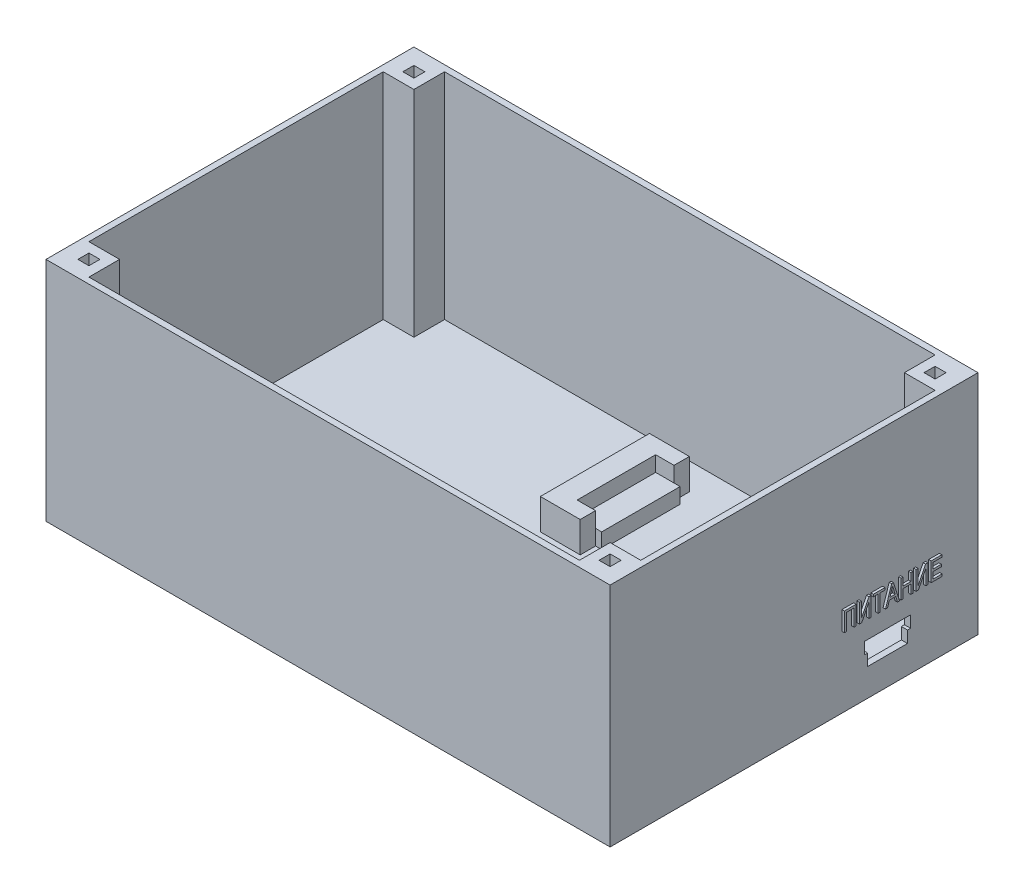
from build123d import *

# Parameters (mm, degrees)
SKETCH_2_W          = 92
SKETCH_2_H          = 60
EXTRUDE_1_DEPTH     = 2
SKETCH_14_W         = 92
SKETCH_14_H         = 60
SKETCH_14_W_2       = 90
SKETCH_14_H_2       = 58
EXTRUDE_9_DEPTH     = 35
SKETCH_18_W         = 4
SKETCH_18_H         = 12.8
EXTRUDE_12_DEPTH    = 2.5
SKETCH_19_W         = 3
SKETCH_19_H         = 2.5
EXTRUDE_13_DEPTH    = 5
SKETCH_20_W         = 3.5
SKETCH_20_H         = 17.8
EXTRUDE_14_DEPTH    = 5
CUT_EXTRUDE_1_DEPTH = 5
SKETCH_21_W         = 2.706084524
SKETCH_21_H         = 20.3
EXTRUDE_16_DEPTH    = 2.5
SKETCH_22_W         = 2.706084524
SKETCH_22_H         = 2.5
EXTRUDE_17_DEPTH    = 5
SKETCH_16_W         = 5
SKETCH_16_H         = 5
SKETCH_16_W_2       = 1.8
SKETCH_16_H_2       = 1.8
EXTRUDE_19_DEPTH    = 35
EXTRUDE_20_DEPTH    = 0.4
SKETCH_24_W         = 9.7
SKETCH_24_H         = 4.6
CUT_EXTRUDE_2_DEPTH = 1
EXTRUDE_21_DEPTH    = 0.4


with BuildPart() as part:
    # Эскиз2 → Бобышка-Вытянуть1 (new body)
    with BuildSketch(Plane(origin=(0, 0, 0), x_dir=(1, 0, 0), z_dir=(0, 1, 0))):
        with Locations((46, 30)):
            Rectangle(SKETCH_2_W, SKETCH_2_H)
    extrude(amount=EXTRUDE_1_DEPTH)



with BuildPart() as body_2:
    # Эскиз14 → Бобышка-Вытянуть9 (new body)
    with BuildSketch(Plane(origin=(0, 2, 0), x_dir=(1, 0, 0), z_dir=(0, 1, 0))):
        with Locations((46, 30)):
            Rectangle(SKETCH_14_W, SKETCH_14_H)
        with Locations((46, 30)):
            Rectangle(SKETCH_14_W_2, SKETCH_14_H_2, mode=Mode.SUBTRACT)
    extrude(amount=EXTRUDE_9_DEPTH)


with BuildPart() as part_1:
    add(part.part)

    add(body_2.part)  # Бобышка-Вытянуть12 merges body 2
    # Эскиз18 → Бобышка-Вытянуть12 (add)
    with BuildSketch(Plane(origin=(0, 2, 0), x_dir=(1, 0, 0), z_dir=(0, 1, 0))):
        with Locations((49.3, 45.72407939)):
            Rectangle(SKETCH_18_W, SKETCH_18_H)
    extrude(amount=EXTRUDE_12_DEPTH)

    # Эскиз19 → Бобышка-Вытянуть13 (add)
    with BuildSketch(Plane(origin=(0, 2, 0), x_dir=(1, 0, 0), z_dir=(0, 1, 0))):
        with Locations((48.8, 38.07407939)):
            Rectangle(SKETCH_19_W, SKETCH_19_H)
        with Locations((48.8, 53.37407939)):
            Rectangle(SKETCH_19_W, SKETCH_19_H)
    extrude(amount=EXTRUDE_13_DEPTH)

    # Эскиз20 → Бобышка-Вытянуть14 (add)
    with BuildSketch(Plane(origin=(0, 2, 0), x_dir=(1, 0, 0), z_dir=(0, 1, 0))):
        with Locations((45.55, 45.72407939)):
            Rectangle(SKETCH_20_W, SKETCH_20_H)
    extrude(amount=EXTRUDE_14_DEPTH)

    # Эскиз17 → Вырез-Вытянуть1 (cut)
    with BuildSketch(Plane(origin=(92, 0, 0), x_dir=(0, 0, -1), z_dir=(1, 0, 0))):
        Polygon((41.5, 8.3), (49, 8.3), (49, 6.4), (48.5, 6.4), (48.5, 4.5), (42, 4.5), (42, 6.4), (41.5, 6.4), align=None)
    extrude(amount=-CUT_EXTRUDE_1_DEPTH, mode=Mode.SUBTRACT)

    # Эскиз21 → Бобышка-Вытянуть16 (add)
    with BuildSketch(Plane(origin=(0, 2, 0), x_dir=(1, 0, 0), z_dir=(0, 1, 0))):
        with Locations((2.353042262, 16.15)):
            Rectangle(SKETCH_21_W, SKETCH_21_H)
        with Locations((89.646957738, 16.15)):
            Rectangle(SKETCH_21_W, SKETCH_21_H)
    extrude(amount=EXTRUDE_16_DEPTH)

    # Эскиз22 → Бобышка-Вытянуть17 (add)
    with BuildSketch(Plane(origin=(0, 2, 0), x_dir=(1, 0, 0), z_dir=(0, 1, 0))):
        with Locations((2.353042262, 27.55)):
            Rectangle(SKETCH_22_W, SKETCH_22_H)
        with Locations((89.646957738, 27.55)):
            Rectangle(SKETCH_22_W, SKETCH_22_H)
    extrude(amount=EXTRUDE_17_DEPTH)

    # Эскиз16 → Бобышка-Вытянуть19 (add)
    # profile 1 of 4: a face of its own
    with BuildSketch(Plane(origin=(0, 2, 0), x_dir=(1, 0, 0), z_dir=(0, 1, 0))):
        with Locations((3.5, 56.5)):
            Rectangle(SKETCH_16_W, SKETCH_16_H)
        with Locations((3.5, 56.5)):
            Rectangle(SKETCH_16_W_2, SKETCH_16_H_2, mode=Mode.SUBTRACT)
    # profile 2 of 4: a face of its own
    with BuildSketch(Plane(origin=(0, 2, 0), x_dir=(1, 0, 0), z_dir=(0, 1, 0))):
        with Locations((88.5, 3.5)):
            Rectangle(SKETCH_16_W, SKETCH_16_H)
        with Locations((88.5, 3.5)):
            Rectangle(SKETCH_16_W_2, SKETCH_16_H_2, mode=Mode.SUBTRACT)
    # profile 3 of 4: a face of its own
    with BuildSketch(Plane(origin=(0, 2, 0), x_dir=(1, 0, 0), z_dir=(0, 1, 0))):
        with Locations((3.5, 3.5)):
            Rectangle(SKETCH_16_W, SKETCH_16_H)
        with Locations((3.5, 3.5)):
            Rectangle(SKETCH_16_W_2, SKETCH_16_H_2, mode=Mode.SUBTRACT)
    # profile 4 of 4: a face of its own
    with BuildSketch(Plane(origin=(0, 2, 0), x_dir=(1, 0, 0), z_dir=(0, 1, 0))):
        with Locations((88.5, 56.5)):
            Rectangle(SKETCH_16_W, SKETCH_16_H)
        with Locations((88.5, 56.5)):
            Rectangle(SKETCH_16_W_2, SKETCH_16_H_2, mode=Mode.SUBTRACT)
    extrude(amount=EXTRUDE_19_DEPTH)

    # Эскиз23 → Бобышка-Вытянуть20 (add)
    # profile 1 of 7: a face of its own
    with BuildSketch(Plane(origin=(92, 0, 0), x_dir=(0, 0, -1), z_dir=(1, 0, 0))):
        Polygon((37.820297464, 14.633638566), (39.716902031, 14.633638566), (39.716902031, 11.551656144), (39.40080127, 11.551656144), (39.40080127, 14.278025209), (38.136398225, 14.278025209), (38.136398225, 11.551656144), (37.820297464, 11.551656144), align=None)
    # profile 2 of 7: a face of its own
    with BuildSketch(Plane(origin=(92, 0, 0), x_dir=(0, 0, -1), z_dir=(1, 0, 0))):
        Polygon((40.270078363, 14.633638566), (40.586179124, 14.633638566), (40.586179124, 12.193118431), (41.807982653, 14.633638566), (42.166682931, 14.633638566), (42.166682931, 11.551656144), (41.850582169, 11.551656144), (41.850582169, 13.986002436), (40.631248178, 11.551656144), (40.270078363, 11.551656144), align=None)
    # profile 3 of 7: a face of its own
    with BuildSketch(Plane(origin=(92, 0, 0), x_dir=(0, 0, -1), z_dir=(1, 0, 0))):
        Polygon((43.31254819, 11.551656144), (43.31254819, 14.278025209), (42.522296287, 14.278025209), (42.522296287, 14.633638566), (44.418900854, 14.633638566), (44.418900854, 14.278025209), (43.628648951, 14.278025209), (43.628648951, 11.551656144), align=None)
    # profile 4 of 7: a face of its own
    with BuildSketch(Plane(origin=(92, 0, 0), x_dir=(0, 0, -1), z_dir=(1, 0, 0))):
        Polygon((44.516447573, 11.551656144), (45.514757985, 14.633638566), (45.812954602, 14.633638566), (46.811265014, 11.551656144), (46.473555802, 11.551656144), (46.192028562, 12.499958427), (45.135066641, 12.499958427), (44.853539401, 11.551656144), align=None)
        with BuildLine():
            Line((45.240639357, 12.855571784), (46.086455846, 12.855571784))
            Line((46.086455846, 12.855571784), (45.84567597, 13.664345216))
            add(Edge.make_bspline(
                [(45.84567597, 13.664345216), (45.836426209, 13.695629271), (45.81840739, 13.756571573), (45.791917269, 13.845492472), (45.766358364, 13.929527401), (45.743018253, 14.008795057), (45.721701904, 14.083295859), (45.700236272, 14.152384308), (45.681371857, 14.216880949), (45.669307011, 14.258268151), (45.663547602, 14.278025209)],
                knots=[0, 0, 0, 0, 1.223089462, 2.382615935, 3.47858657, 4.516186366, 5.480638401, 6.383728134, 7.228438372, 8, 8, 8, 8], degree=3))
            add(Edge.make_bspline(
                [(45.663547602, 14.278025209), (45.635377776, 14.18294088), (45.578724644, 13.9917141), (45.521779603, 13.800574044), (45.493149535, 13.704475195)],
                knots=[0, 0, 0, 0, 0.994466669, 2, 2, 2, 2], degree=3))
            Line((45.493149535, 13.704475195), (45.240639357, 12.855571784))
        make_face(mode=Mode.SUBTRACT)
    # profile 5 of 7: a face of its own
    with BuildSketch(Plane(origin=(92, 0, 0), x_dir=(0, 0, -1), z_dir=(1, 0, 0))):
        Polygon((47.066244729, 11.551656144), (47.066244729, 14.633638566), (47.382345491, 14.633638566), (47.382345491, 13.369235521), (48.646748535, 13.369235521), (48.646748535, 14.633638566), (48.962849297, 14.633638566), (48.962849297, 11.551656144), (48.646748535, 11.551656144), (48.646748535, 13.013622164), (47.382345491, 13.013622164), (47.382345491, 11.551656144), align=None)
    # profile 6 of 7: a face of its own
    with BuildSketch(Plane(origin=(92, 0, 0), x_dir=(0, 0, -1), z_dir=(1, 0, 0))):
        Polygon((49.516025629, 14.633638566), (49.83212639, 14.633638566), (49.83212639, 12.193118431), (51.053929918, 14.633638566), (51.412630196, 14.633638566), (51.412630196, 11.551656144), (51.096529435, 11.551656144), (51.096529435, 13.986002436), (49.877195444, 11.551656144), (49.516025629, 11.551656144), align=None)
    # profile 7 of 7: a face of its own
    with BuildSketch(Plane(origin=(92, 0, 0), x_dir=(0, 0, -1), z_dir=(1, 0, 0))):
        Polygon((51.965806528, 11.551656144), (51.965806528, 14.633638566), (53.704360715, 14.633638566), (53.704360715, 14.278025209), (52.28190729, 14.278025209), (52.28190729, 13.329722926), (53.625335525, 13.329722926), (53.625335525, 12.974109569), (52.28190729, 12.974109569), (52.28190729, 11.9072695), (53.74387331, 11.9072695), (53.74387331, 11.551656144), align=None)
    extrude(amount=EXTRUDE_20_DEPTH)

    # Эскиз24 → Вырез-Вытянуть2 (cut)
    with BuildSketch(Plane(origin=(1, 0, 0), x_dir=(0, 0, -1), z_dir=(1, 0, 0))):
        with Locations((17.746202532, 11.8)):
            Rectangle(SKETCH_24_W, SKETCH_24_H)
    extrude(amount=-CUT_EXTRUDE_2_DEPTH, mode=Mode.SUBTRACT)

    # Эскиз25 → Бобышка-Вытянуть21 (add)
    # profile 1 of 4: a face of its own
    with BuildSketch(Plane.ZY):
        with BuildLine():
            Line((-21.91266946, 21.587525959), (-21.348566896, 21.587525959))
            Line((-21.348566896, 21.587525959), (-21.348566896, 19.286243907))
            add(Edge.make_bspline(
                [(-21.348566896, 19.286243907), (-21.349152296, 19.237361581), (-21.350291487, 19.142236492), (-21.355532254, 19.003507344), (-21.365741505, 18.872486692), (-21.381371643, 18.749386429), (-21.399041567, 18.633672637), (-21.422575164, 18.525977914), (-21.44956627, 18.425867611), (-21.48062205, 18.332665361), (-21.518212184, 18.245741512), (-21.561159024, 18.163234693), (-21.611241968, 18.084904012), (-21.668331124, 18.010868358), (-21.732729396, 17.941532411), (-21.802678319, 17.875118809), (-21.880024387, 17.81345329), (-21.963916737, 17.755829963), (-22.05445955, 17.703532236), (-22.152049202, 17.658411678), (-22.256566645, 17.621210837), (-22.367539929, 17.589562805), (-22.485523063, 17.566099186), (-22.610137547, 17.548301586), (-22.741548365, 17.537833279), (-22.831454139, 17.536781544), (-22.877413049, 17.536243907)],
                knots=[0, 0, 0, 0, 1.311435591, 2.552055809, 3.723716842, 4.835547674, 5.880436826, 6.862821995, 7.791032428, 8.661143393, 9.495683908, 10.328993084, 11.1538804, 11.986573222, 12.833449924, 13.690091648, 14.571895854, 15.484149563, 16.418232274, 17.373591634, 18.364096258, 19.391643703, 20.466661433, 21.588422397, 22.767226238, 24, 24, 24, 24], degree=3))
            add(Edge.make_bspline(
                [(-22.877413049, 17.536243907), (-22.922297532, 17.536904605), (-23.009751443, 17.538191923), (-23.137907465, 17.546896763), (-23.259812, 17.562322693), (-23.375832956, 17.582566983), (-23.485580893, 17.610003348), (-23.588892874, 17.643585704), (-23.686121619, 17.682868601), (-23.777278753, 17.727563237), (-23.861298634, 17.779165575), (-23.939666638, 17.835491537), (-24.012032366, 17.897154443), (-24.077723568, 17.964710082), (-24.137519084, 18.037141164), (-24.19058553, 18.115221784), (-24.237049976, 18.199091201), (-24.278080798, 18.288528567), (-24.313829847, 18.384850395), (-24.342656463, 18.489369394), (-24.368735909, 18.601817292), (-24.388752416, 18.722602621), (-24.40633476, 18.851573712), (-24.416530876, 18.989111723), (-24.424299296, 19.134980024), (-24.425086211, 19.234949916), (-24.425489973, 19.286243907)],
                knots=[0, 0, 0, 0, 1.192889473, 2.324252067, 3.41162405, 4.457325556, 5.452435892, 6.415456921, 7.342133401, 8.237363544, 9.110250727, 9.959377435, 10.800155199, 11.633438097, 12.46053001, 13.293359256, 14.138649731, 15.005774073, 15.906391469, 16.865847877, 17.8852706, 18.972920589, 20.118424796, 21.343408205, 22.636917643, 24, 24, 24, 24], degree=3))
            Line((-24.425489973, 19.286243907), (-24.425489973, 21.587525959))
            Line((-24.425489973, 21.587525959), (-23.861387408, 21.587525959))
            Line((-23.861387408, 21.587525959), (-23.861387408, 19.312686215))
            add(Edge.make_bspline(
                [(-23.861387408, 19.312686215), (-23.861018817, 19.271284627), (-23.860307614, 19.191399654), (-23.856597014, 19.075677295), (-23.849176462, 18.968287646), (-23.840002694, 18.869066763), (-23.827390461, 18.778372952), (-23.811239141, 18.696339037), (-23.793122729, 18.622685649), (-23.765993641, 18.536551545), (-23.720961921, 18.440400946), (-23.649995151, 18.338489174), (-23.563401579, 18.249952501), (-23.460352664, 18.17683518), (-23.343329045, 18.118738028), (-23.213119591, 18.078679324), (-23.071269065, 18.052917649), (-22.972618471, 18.050379864), (-22.921483562, 18.04906442)],
                knots=[0, 0, 0, 0, 1.090245215, 2.103644224, 3.048223674, 3.924421557, 4.727106666, 5.45815927, 6.12513286, 6.723455763, 7.834131158, 8.905266051, 9.9795367, 11.078391299, 12.21701853, 13.404826756, 14.65480846, 16, 16, 16, 16], degree=3))
            add(Edge.make_bspline(
                [(-22.921483562, 18.04906442), (-22.877657231, 18.04981052), (-22.79303302, 18.051251162), (-22.671007312, 18.062869444), (-22.559138927, 18.084049815), (-22.456499413, 18.111344406), (-22.363811065, 18.14841188), (-22.28050716, 18.193321227), (-22.206879998, 18.246314124), (-22.14240125, 18.308826245), (-22.086844318, 18.383633745), (-22.040019901, 18.472786138), (-22.000131123, 18.576361119), (-21.967442781, 18.694700611), (-21.9436084, 18.82836667), (-21.924976291, 18.976498403), (-21.91520653, 19.139747051), (-21.913539495, 19.253380354), (-21.91266946, 19.312686215)],
                knots=[0, 0, 0, 0, 1.111629428, 2.146443922, 3.104513091, 3.997025448, 4.836178689, 5.630482806, 6.392099463, 7.129930272, 7.899580577, 8.745272349, 9.676297551, 10.710246713, 11.854352966, 13.117392195, 14.495550762, 16, 16, 16, 16], degree=3))
            Line((-21.91266946, 19.312686215), (-21.91266946, 21.587525959))
        make_face()
    # profile 2 of 4: a face of its own
    with BuildSketch(Plane.ZY):
        Polygon((-20.972765614, 17.587525959), (-19.384624588, 21.587525959), (-18.748406639, 21.587525959), (-17.160265614, 17.587525959), (-17.758823306, 17.587525959), (-18.213951511, 18.818295189), (-19.919079716, 18.818295189), (-20.374207921, 17.587525959), align=None)
        with BuildLine():
            Line((-19.749207921, 19.279833651), (-18.383823306, 19.279833651))
            Line((-18.383823306, 19.279833651), (-18.772445101, 20.331115702))
            add(Edge.make_bspline(
                [(-18.772445101, 20.331115702), (-18.787343473, 20.371735808), (-18.816472603, 20.451155784), (-18.859912913, 20.566546306), (-18.89959928, 20.676125881), (-18.938515021, 20.778323296), (-18.973644956, 20.874623071), (-19.006025118, 20.964374744), (-19.038048824, 21.046954499), (-19.057266701, 21.100309529), (-19.066515614, 21.125987497)],
                knots=[0, 0, 0, 0, 1.225184869, 2.395467751, 3.491410812, 4.525364584, 5.492066482, 6.394148129, 7.227157926, 8, 8, 8, 8], degree=3))
            add(Edge.make_bspline(
                [(-19.066515614, 21.125987497), (-19.0818151, 21.06266789), (-19.112477158, 20.93576759), (-19.176676043, 20.749841626), (-19.250117337, 20.565616039), (-19.309760419, 20.446902329), (-19.339752793, 20.387205446)],
                knots=[0, 0, 0, 0, 0.9891762, 1.982431084, 2.985436691, 4, 4, 4, 4], degree=3))
            Line((-19.339752793, 20.387205446), (-19.749207921, 19.279833651))
        make_face(mode=Mode.SUBTRACT)
    # profile 3 of 4: a face of its own
    with BuildSketch(Plane.ZY):
        with BuildLine():
            Line((-16.73318228, 17.587525959), (-16.73318228, 21.587525959))
            Line((-16.73318228, 21.587525959), (-14.997605357, 21.587525959))
            add(Edge.make_bspline(
                [(-14.997605357, 21.587525959), (-14.956737835, 21.587205745), (-14.877643529, 21.586586008), (-14.762940454, 21.582198977), (-14.655876633, 21.572741688), (-14.55625521, 21.562514948), (-14.464093886, 21.546818268), (-14.379487742, 21.528814531), (-14.302306148, 21.507389811), (-14.232204058, 21.482085566), (-14.167164604, 21.453457604), (-14.106877943, 21.41813532), (-14.048838035, 21.379429628), (-13.995198946, 21.333956217), (-13.944545938, 21.28416704), (-13.896925958, 21.229385569), (-13.853043982, 21.169136412), (-13.798920819, 21.082907374), (-13.740857701, 20.968068454), (-13.692482003, 20.821099519), (-13.661290219, 20.667364648), (-13.657952609, 20.562304674), (-13.656259203, 20.509000318)],
                knots=[0, 0, 0, 0, 1.242255013, 2.404239178, 3.487702428, 4.508875116, 5.447164253, 6.327763259, 7.137389581, 7.87956647, 8.591787438, 9.293660819, 10.000726923, 10.709654955, 11.427269343, 12.158170644, 12.913245971, 13.690346794, 15.251572448, 16.809945773, 18.381459854, 20, 20, 20, 20], degree=3))
            add(Edge.make_bspline(
                [(-13.656259203, 20.509000318), (-13.657041934, 20.474783675), (-13.65858788, 20.407203459), (-13.670429985, 20.307842452), (-13.691857318, 20.212907005), (-13.71933365, 20.121565692), (-13.756940365, 20.035112671), (-13.800506112, 19.951782114), (-13.854477879, 19.873863334), (-13.914905241, 19.799281478), (-13.98419922, 19.72963389), (-14.062969395, 19.667433285), (-14.150434934, 19.611483716), (-14.247007766, 19.563328854), (-14.351576239, 19.519313024), (-14.465452401, 19.483869357), (-14.588176658, 19.454926884), (-14.673254817, 19.440911822), (-14.717156639, 19.433679805)],
                knots=[0, 0, 0, 0, 0.982609109, 1.940720374, 2.867584677, 3.775009516, 4.675469332, 5.571146231, 6.471115823, 7.392408543, 8.32534739, 9.286126426, 10.269214477, 11.301811357, 12.381622301, 13.524260118, 14.722474812, 16, 16, 16, 16], degree=3))
            add(Edge.make_bspline(
                [(-14.717156639, 19.433679805), (-14.68495299, 19.417411231), (-14.6237971, 19.386516625), (-14.539126012, 19.33807415), (-14.467353262, 19.288577878), (-14.425771671, 19.253176689), (-14.406259203, 19.23656442)],
                knots=[0, 0, 0, 0, 1.172304973, 2.226249348, 3.167654437, 4, 4, 4, 4], degree=3))
            add(Edge.make_bspline(
                [(-14.406259203, 19.23656442), (-14.368472207, 19.199522121), (-14.290855031, 19.123434607), (-14.183895192, 18.993835281), (-14.080193955, 18.849571345), (-14.017187634, 18.745311309), (-13.984784844, 18.691692625)],
                knots=[0, 0, 0, 0, 0.918110279, 1.885863737, 2.912745394, 4, 4, 4, 4], degree=3))
            Line((-13.984784844, 18.691692625), (-13.328534844, 17.587525959))
            Line((-13.328534844, 17.587525959), (-13.97516946, 17.587525959))
            Line((-13.97516946, 17.587525959), (-14.473566896, 18.432077241))
            add(Edge.make_bspline(
                [(-14.473566896, 18.432077241), (-14.491486764, 18.461709337), (-14.526212526, 18.519131476), (-14.576372646, 18.602993744), (-14.625552995, 18.680202324), (-14.671166926, 18.75296388), (-14.715065532, 18.81995746), (-14.756824647, 18.881415787), (-14.795295043, 18.938145115), (-14.842945602, 19.004192816), (-14.898402938, 19.07727521), (-14.963117844, 19.152536275), (-15.024745622, 19.21254092), (-15.100641369, 19.271381857), (-15.194649732, 19.326417663), (-15.274558616, 19.351705104), (-15.313310485, 19.363968266)],
                knots=[0, 0, 0, 0, 1.130940588, 2.191577161, 3.191089816, 4.120344442, 4.99615009, 5.80661983, 6.546979556, 7.234477901, 8.466216387, 9.541989141, 10.473533583, 11.269175393, 12.675684693, 14, 14, 14, 14], degree=3))
            add(Edge.make_bspline(
                [(-15.313310485, 19.363968266), (-15.329569333, 19.366900289), (-15.366688771, 19.373594185), (-15.429717483, 19.37796598), (-15.506084501, 19.382606054), (-15.56142898, 19.382470858), (-15.591355357, 19.382397753)],
                knots=[0, 0, 0, 0, 0.709978628, 1.620902492, 2.713552433, 4, 4, 4, 4], degree=3))
            Line((-15.591355357, 19.382397753), (-16.169079716, 19.382397753))
            Line((-16.169079716, 19.382397753), (-16.169079716, 17.587525959))
            Line((-16.169079716, 17.587525959), (-16.73318228, 17.587525959))
        make_face()
        with BuildLine():
            Line((-16.169079716, 19.843936215), (-15.097765614, 19.843936215))
            add(Edge.make_bspline(
                [(-15.097765614, 19.843936215), (-15.044045866, 19.844776711), (-14.943621838, 19.846347941), (-14.803194721, 19.859764586), (-14.683519572, 19.881084206), (-14.582230585, 19.912181368), (-14.497131847, 19.955354556), (-14.423119858, 20.007969152), (-14.361614964, 20.073874412), (-14.310449245, 20.148234466), (-14.270677082, 20.230063993), (-14.241987341, 20.316013915), (-14.223209406, 20.405361876), (-14.221319388, 20.466170862), (-14.220361767, 20.496981087)],
                knots=[0, 0, 0, 0, 1.546323217, 2.890706218, 4.056530419, 5.041445823, 5.928701482, 6.793137403, 7.641659452, 8.509781392, 9.383301667, 10.251423607, 11.114044887, 12, 12, 12, 12], degree=3))
            add(Edge.make_bspline(
                [(-14.220361767, 20.496981087), (-14.221106277, 20.519433669), (-14.222564553, 20.563411682), (-14.230209316, 20.627959196), (-14.245072552, 20.689294253), (-14.264699417, 20.747741079), (-14.290924893, 20.802871591), (-14.322079688, 20.85511299), (-14.359256976, 20.904175733), (-14.40184142, 20.950209274), (-14.450736101, 20.992095297), (-14.506585322, 21.02823385), (-14.568948603, 21.058943824), (-14.63789843, 21.083317313), (-14.713217601, 21.102812136), (-14.79533489, 21.115781413), (-14.883874757, 21.125165938), (-14.94522775, 21.125708528), (-14.976772024, 21.125987497)],
                knots=[0, 0, 0, 0, 0.965208469, 1.890559848, 2.786986821, 3.67262109, 4.535197034, 5.405224191, 6.282113641, 7.175449223, 8.095446547, 9.040936516, 10.026471658, 11.075712529, 12.17809725, 13.364958037, 14.645208957, 16, 16, 16, 16], degree=3))
            Line((-14.976772024, 21.125987497), (-16.169079716, 21.125987497))
            Line((-16.169079716, 21.125987497), (-16.169079716, 19.843936215))
        make_face(mode=Mode.SUBTRACT)
    # profile 4 of 4: a face of its own
    with BuildSketch(Plane.ZY):
        Polygon((-11.758823306, 17.587525959), (-11.758823306, 21.125987497), (-13.040874588, 21.125987497), (-13.040874588, 21.587525959), (-9.91266946, 21.587525959), (-9.91266946, 21.125987497), (-11.194720742, 21.125987497), (-11.194720742, 17.587525959), align=None)
    extrude(amount=EXTRUDE_21_DEPTH)


solid = part_1.part
